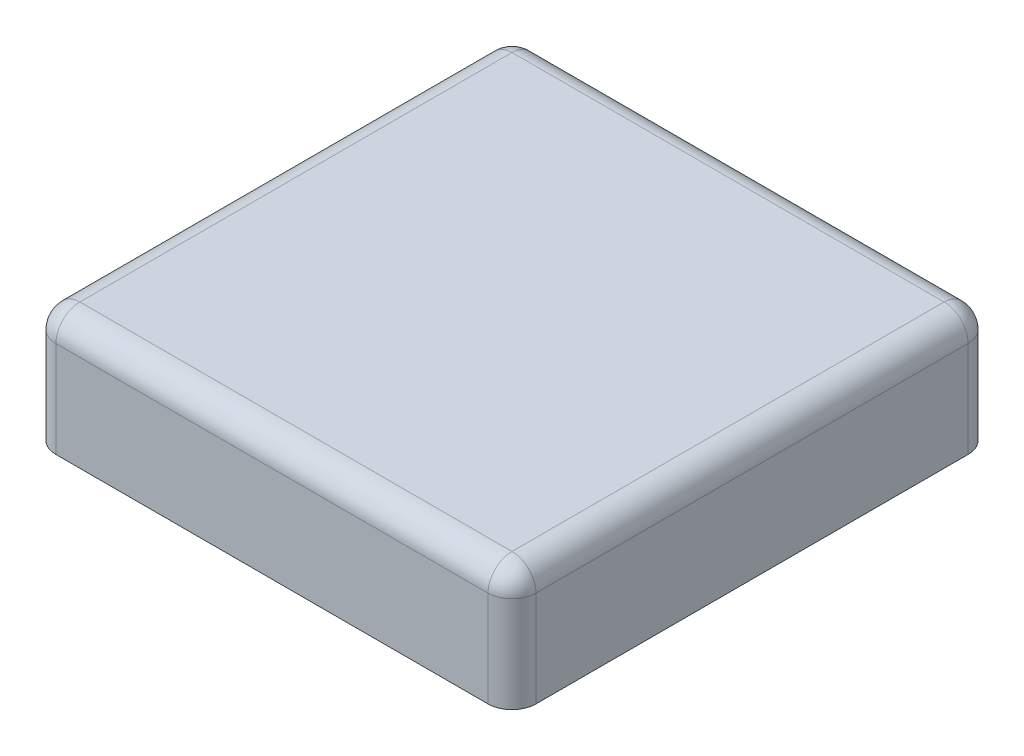
from build123d import *

# Parameters (mm, degrees)
SKETCH1_W           = 60
SKETCH1_H           = 60
BOSS_EXTRUDE1_DEPTH = 15
FILLET1_R           = 3
SHELL1_START        = -27
SHELL1_OUTLINE_W    = 12
SHELL1_OUTLINE_H    = 54
SHELL1_DEPTH        = 54


# Read off the part's stored shape, not the designer's step: Shell1
with BuildPart() as part:
    # Sketch1 → Boss-Extrude1 (new body)
    with BuildSketch(Plane(origin=(0, 0, 0), x_dir=(1, 0, 0), z_dir=(0, 1, 0))):
        Rectangle(SKETCH1_W, SKETCH1_H)
    extrude(amount=BOSS_EXTRUDE1_DEPTH)

    # Fillet1
    fillet1_edges = [part.edges().sort_by_distance(p)[0] for p in [
        (30, 15, 0),
        (0, 15, -30),
        (-30, 15, 0),
        (0, 15, 30),
        (-30, 7.5, -30),
        (30, 7.5, -30),
        (30, 7.5, 30),
        (-30, 7.5, 30),
    ]]
    fillet(fillet1_edges, radius=FILLET1_R)

    # Shell1 outline → Shell1 (cut)
    with BuildSketch(Plane.YZ.offset(SHELL1_START)):
        with Locations((6, 0)):
            Rectangle(SHELL1_OUTLINE_W, SHELL1_OUTLINE_H)
    extrude(amount=SHELL1_DEPTH, mode=Mode.SUBTRACT)


solid = part.part
